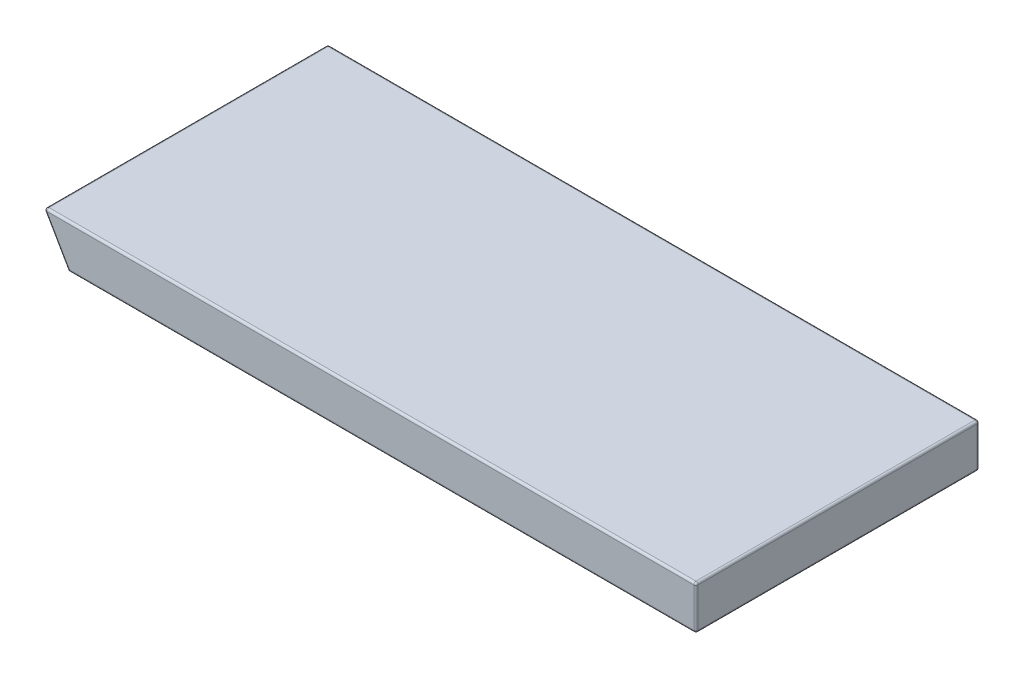
from build123d import *

# Parameters (mm, degrees)
SKETCH1_W          = 154
SKETCH1_H          = 65
BASE_DEPTH         = 10
CUT_EXTRUDE1_DEPTH = 102.262036322
FILLET1_R          = 0.5


with BuildPart() as part:
    # Sketch1 → base (new body)
    with BuildSketch(Plane(origin=(0, 0, 0), x_dir=(1, 0, 0), z_dir=(0, 1, 0))):
        Rectangle(SKETCH1_W, SKETCH1_H)
    extrude(amount=BASE_DEPTH)

    # Sketch5 → Cut-Extrude1 (cut, through all)
    with BuildSketch(Plane.XY.offset(32.5)):
        Polygon((-232.097836483, 285.957841008), (-72.773502692, 10), (-67, 0), (-77, 0), (-395.648667582, 0), (-948.855705139, 316.401433314), (-785.30487404, 602.359274322), align=None)
    extrude(amount=-CUT_EXTRUDE1_DEPTH, mode=Mode.SUBTRACT)

    # Fillet1
    fillet1_edges = [part.edges().sort_by_distance(p)[0] for p in [
        (77, 5, -32.5),
        (77, 5, 32.5),
        (2.113248654, 10, -32.5),
        (2.113248654, 10, 32.5),
        (77, 10, 0),
        (5, 0, -32.5),
        (5, 0, 32.5),
        (77, 0, 0),
        (-67, 0, 0),
        (-69.886751346, 5, -32.5),
        (-72.773502692, 10, 0),
        (-69.886751346, 5, 32.5),
    ]]
    fillet(fillet1_edges, radius=FILLET1_R)


solid = part.part
